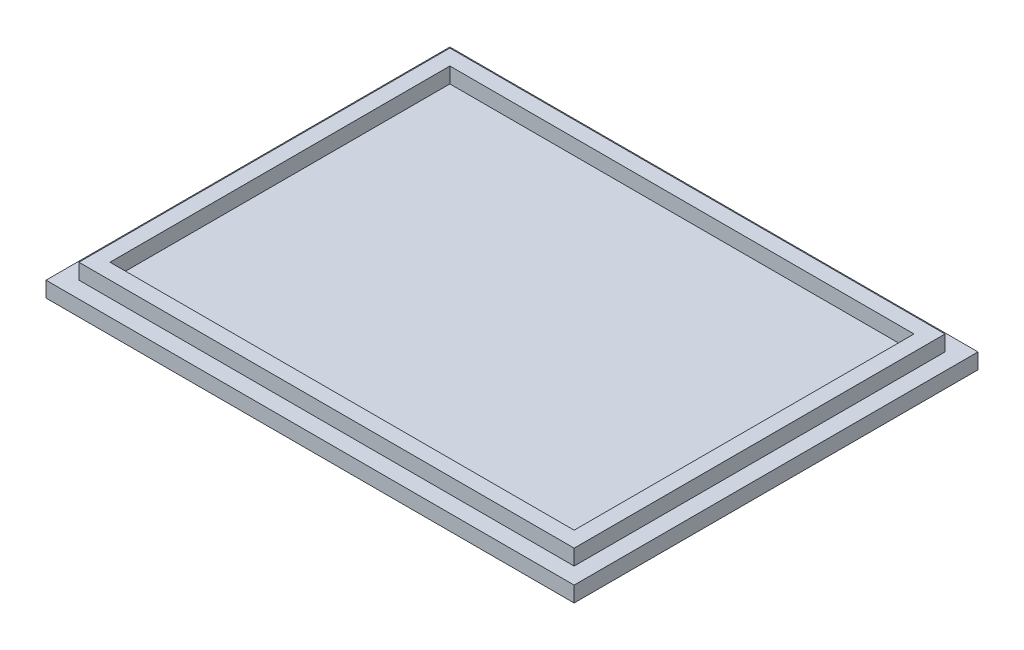
from build123d import *

# Parameters (mm, degrees)
SKETCH_1_W        = 85
SKETCH_1_H        = 65
EXTRUDE_1_DEPTH   = 2.5
SKETCH_3_W        = 79.7
SKETCH_3_H        = 59.7
EXTRUDE_2_DEPTH   = 2.5
SHELL_START       = 2.5
SHELL_1_OUTLINE_W = 74.7
SHELL_1_OUTLINE_H = 54.7
SHELL_1_DEPTH     = 2.5


# Read off the part's stored shape, not the designer's step: 抽壳1
with BuildPart() as part:
    # 草图1 → 凸台-拉伸1 (new body)
    with BuildSketch(Plane(origin=(0, 0, 0), x_dir=(1, 0, 0), z_dir=(0, 1, 0))):
        Rectangle(SKETCH_1_W, SKETCH_1_H)
    extrude(amount=EXTRUDE_1_DEPTH)

    # 草图3 → 凸台-拉伸2 (add)
    with BuildSketch(Plane(origin=(0, 2.5, 0), x_dir=(1, 0, 0), z_dir=(0, 1, 0))):
        Rectangle(SKETCH_3_W, SKETCH_3_H)
    extrude(amount=EXTRUDE_2_DEPTH)

    # 抽壳1 outline → 抽壳1 (cut)
    with BuildSketch(Plane(origin=(0, 0, 0), x_dir=(1, 0, 0), z_dir=(0, 1, 0)).offset(SHELL_START)):
        Rectangle(SHELL_1_OUTLINE_W, SHELL_1_OUTLINE_H)
    extrude(amount=SHELL_1_DEPTH, mode=Mode.SUBTRACT)


solid = part.part
